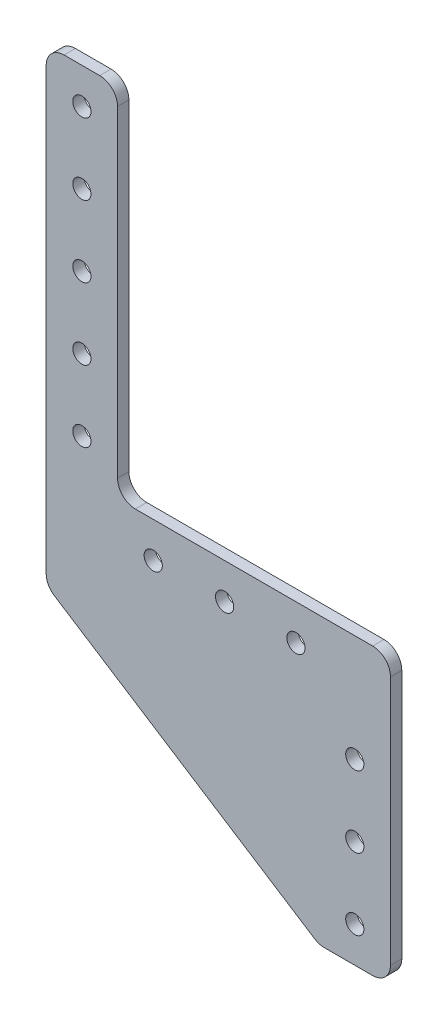
from build123d import *

# Parameters (mm, degrees)
SKETCH1_R           = 2.55
BOSS_EXTRUDE1_DEPTH = 1.5875
FILLET1_R           = 5


with BuildPart() as part:
    # Sketch1 → Boss-Extrude1 (new, symmetric)
    with BuildSketch(Plane.XY):
        Polygon((-56.5, 120.217645026), (-76.5, 120.217645026), (-76.5, -10.932354974), (0, -60), (20, -60), (20, 20), (-56.5, 20), align=None)
        with Locations((-46.5, 10)):
            Circle(SKETCH1_R, mode=Mode.SUBTRACT)
        with Locations((10, -50)):
            Circle(SKETCH1_R, mode=Mode.SUBTRACT)
        with Locations((10, -30)):
            Circle(SKETCH1_R, mode=Mode.SUBTRACT)
        with Locations((-26.5, 10)):
            Circle(SKETCH1_R, mode=Mode.SUBTRACT)
        with Locations((-6.5, 10)):
            Circle(SKETCH1_R, mode=Mode.SUBTRACT)
        with Locations((10, -10)):
            Circle(SKETCH1_R, mode=Mode.SUBTRACT)
        with Locations((-66.5, 30.217645026)):
            Circle(SKETCH1_R, mode=Mode.SUBTRACT)
        with Locations((-66.5, 50.217645026)):
            Circle(SKETCH1_R, mode=Mode.SUBTRACT)
        with Locations((-66.5, 70.217645026)):
            Circle(SKETCH1_R, mode=Mode.SUBTRACT)
        with Locations((-66.5, 90.217645026)):
            Circle(SKETCH1_R, mode=Mode.SUBTRACT)
        with Locations((-66.5, 110.217645026)):
            Circle(SKETCH1_R, mode=Mode.SUBTRACT)
    extrude(amount=BOSS_EXTRUDE1_DEPTH, both=True)

    # Fillet1
    fillet1_edges = [part.edges().sort_by_distance(p)[0] for p in [
        (-76.5, -10.932354974, 0),
        (0, -60, 0),
        (20, -60, 0),
        (20, 20, 0),
        (-56.5, 20, 0),
        (-76.5, 120.217645026, 0),
        (-56.5, 120.217645026, 0),
    ]]
    fillet(fillet1_edges, radius=FILLET1_R)


solid = part.part
